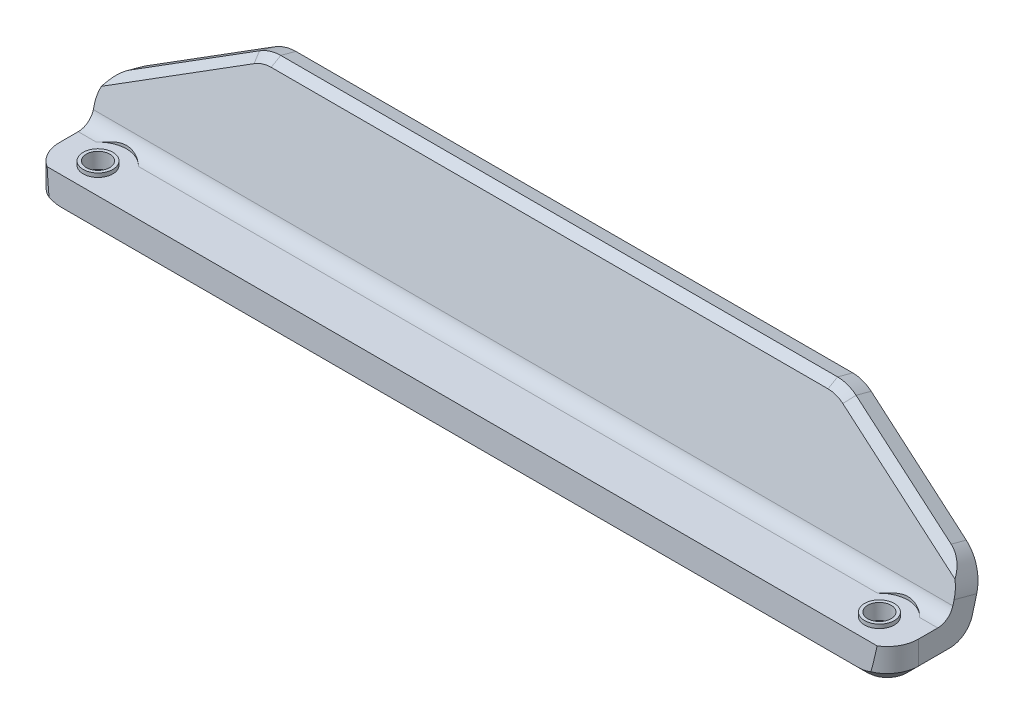
from build123d import *
from build123d.topology import SkipClean

# Parameters (mm, degrees)
SKETCH1_R           = 1.5
BOSS_EXTRUDE1_DEPTH = 4.5
BOSS_EXTRUDE2_DEPTH = 4.5
SKETCH4_W           = 111.548343993
SKETCH4_H           = 26.061405498
CUT_EXTRUDE1_DEPTH  = 60.696351463
FILLET4_R           = 5
FILLET1_R           = 4.5
FILLET2_SIZE        = 1.5
FILLET3_R           = 2
CUT_EXTRUDE2_DEPTH  = 113.379618024
SKETCH6_R           = 3
CUT_EXTRUDE3_DEPTH  = 3
SKETCH7_R           = 3.65
CUT_EXTRUDE4_DEPTH  = 59.224472924
SKETCH8_R           = 1.9
SKETCH8_R_2         = 1.5
BOSS_EXTRUDE3_DEPTH = 0.5
CUT_EXTRUDE5_DEPTH  = 1
CUT_EXTRUDE6_START  = -9.108877
CUT_EXTRUDE6_DEPTH  = 19.773151802
CUT_EXTRUDE7_START  = -32.882028
CUT_EXTRUDE7_DEPTH  = 20.117971694
CUT_EXTRUDE8_DEPTH  = 1
CUT_EXTRUDE9_START  = -28.882028802
CUT_EXTRUDE9_DEPTH  = 19.773151802
CUT_EXTRUDE10_START = -52.999999694
CUT_EXTRUDE10_DEPTH = 20.117971694
CHAMFER2_SIZE       = 1


# Some blends are built 0.0001 mm under size
with BuildPart() as part:
    # Sketch1 → Boss-Extrude1 (new body)
    with BuildSketch(Plane(origin=(0, 0, 0), x_dir=(1, 0, 0), z_dir=(0, 1, 0))):
        with BuildLine():
            Line((51, -4), (-51, -4))
            ThreePointArc((-51, -4), (-53.828427125, -2.828427125), (-55, 0))
            Line((-55, 0), (-55, 4))
            Line((-55, 4), (55, 4))
            Line((55, 4), (55, 0))
            ThreePointArc((55, 0), (53.828427125, -2.828427125), (51, -4))
        make_face()
        with Locations(Location((-50, 0, 0), (0, 0, 270))):
            Circle(SKETCH1_R, mode=Mode.SUBTRACT)
        with Locations(Location((50, 0, 0), (0, 0, 270))):
            Circle(SKETCH1_R, mode=Mode.SUBTRACT)
    extrude(amount=BOSS_EXTRUDE1_DEPTH)

    # Sketch3 → Boss-Extrude2 (add)
    with BuildSketch(Plane(origin=(0, -0.698557159, -2.607050808), x_dir=(0, 0.9659258262890672, -0.25881904510252496), z_dir=(0, -0.25881904510252496, -0.9659258262890672))):
        Polygon((1.03527618, 55), (10.381942399, 55), (21.03527618, 37), (21.03527618, -37), (10.381942399, -55), (1.03527618, -55), align=None)
    extrude(amount=BOSS_EXTRUDE2_DEPTH)

    # Sketch4 → Cut-Extrude1 (cut, through all)
    with BuildSketch(Plane.XZ):
        with Locations((0.774171997, -1.424514274)):
            Rectangle(SKETCH4_W, SKETCH4_H)
    extrude(amount=CUT_EXTRUDE1_DEPTH, mode=Mode.SUBTRACT)

    # Fillet4
    fillet4_edges = [part.edges().sort_by_distance(p)[0] for p in [
        (55, 8.74728628, -7.467428335),
        (-55, 8.74728628, -7.467428335),
        (-37, 19.037616516, -10.224714011),
        (37, 19.037616516, -10.224714011),
    ]]
    fillet(fillet4_edges, radius=FILLET4_R)

    # Fillet1
    fillet1_edges = [part.edges().sort_by_distance(p)[0] for p in [
        (0, 0, -7.452971446),
    ]]
    fillet(fillet1_edges, radius=FILLET1_R)

    # Fillet2
    fillet2_edges = [part.edges().sort_by_distance(p)[0] for p in [
        (55, 0, -2),
        (-45.362278742, 13.674684232, -11.117092043),
        (53.828427125, 0, 2.828427125),
        (0, 18.455273664, -12.39804712),
        (45.362278742, 13.674684232, -11.117092043),
        (55, 4.373280482, -8.624788419),
        (0, 0, 4),
        (54.343573621, 7.80342359, -9.543892495),
        (36.951427354, 18.283885012, -12.352123669),
        (-36.951427354, 18.283885012, -12.352123669),
        (-54.343573621, 7.80342359, -9.543892495),
        (-53.828427125, 0, 2.828427125),
        (-55, 0, -2),
        (55, 0.929909969, -6.739426431),
        (-55, 4.373280482, -8.624788419),
        (-55, 0.929909969, -6.739426431),
    ]]
    chamfer(fillet2_edges, length=FILLET2_SIZE)

    # Fillet3
    fillet3_edges = [part.edges().sort_by_distance(p)[0] for p in [
        (0, 4.5, -4),
    ]]
    fillet(fillet3_edges, radius=FILLET3_R)

    # Sketch5 → Cut-Extrude2 (cut, through all)
    with BuildSketch(Plane(origin=(55, 0, 0), x_dir=(0, 0, -1), z_dir=(1, 0, 0))):
        Polygon((-3.7, 1.2), (-3.4, 4.5), (-4, 4.5), (-4, 1.5), align=None)
    extrude(amount=-CUT_EXTRUDE2_DEPTH, mode=Mode.SUBTRACT)

    # Sketch6 → Cut-Extrude3 (cut)
    with BuildSketch(Plane.XZ):
        with Locations(Location((-50, 0, 0), (0, 0, 270))):
            Circle(SKETCH6_R)
        with Locations(Location((50, 0, 0), (0, 0, 270))):
            Circle(SKETCH6_R)
    extrude(amount=-CUT_EXTRUDE3_DEPTH, mode=Mode.SUBTRACT)

    # Chamfer1
    # the kernel refuses this chamfer: 1 mm, written as the material it takes off along each edge
    with BuildSketch(Plane(origin=(-38.177904762, 18.946568868, -7.870946462), x_dir=(0.5091379751453899, -0.8238169892328391, 0.24920692309041603), z_dir=(-0.8605709712337539, -0.49197552696425445, 0.1318244451459503)), Plane(origin=(57.858130466, 7.695678779, -4.856279548), x_dir=(-0.5091379751453895, -0.8238169892328395, 0.24920692309041592), z_dir=(-0.8605709712337543, 0.491975526964254, -0.13182444514595018))) as chamfer1_piece_1:
        with BuildLine():
            Line((1.028673195, 0), (-0.056547155, -1.027117794))
            Line((-0.056547155, -1.027117794), (-0.076539593, -1.026567876))
            ThreePointArc((-0.076539593, -1.026567876), (-0.034129227, -0.51339783), (-0.019992438, 0.000549918))
            Line((-0.019992438, 0.000549918), (0.000549918, 0.019992438))
            ThreePointArc((0.000549918, 0.019992438), (0.514497665, 0.00585565), (1.029223113, 0.019992438))
            Line((1.029223113, 0.019992438), (1.028673195, 0))
        make_face()
    extrude(amount=22.868800322, mode=Mode.SUBTRACT)
    with BuildSketch(Plane(origin=(35.63125204, 19.619959367, -8.051380902), x_dir=(0, -0.9584441695405964, 0.28528016733316086), z_dir=(-1, 0, 0))) as chamfer1_piece_2:
        with BuildLine():
            Line((1.028673195, 0), (-0.056547155, -1.027117794))
            Line((-0.056547155, -1.027117794), (-0.076539593, -1.026567876))
            ThreePointArc((-0.076539593, -1.026567876), (-0.034129227, -0.51339783), (-0.019992438, 0.000549918))
            Line((-0.019992438, 0.000549918), (0.000549918, 0.019992438))
            ThreePointArc((0.000549918, 0.019992438), (0.514497665, 0.00585565), (1.029223113, 0.019992438))
            Line((1.029223113, 0.019992438), (1.028673195, 0))
        make_face()
    extrude(amount=71.262504079, mode=Mode.SUBTRACT)
    with BuildSketch(Plane(origin=(35.63125204, 14.790330236, -6.757285677), x_dir=(0.5093305444107913, 0.831247726469349, -0.22273215701767274), z_dir=(0.8605709712337541, -0.491975526964254, 0.13182444514595018))) as chamfer1_piece_3:
        with BuildLine():
            Line((3.971715729, 0.028284271), (5.028284271, -1.028284271))
            Line((5.028284271, -1.028284271), (5.048284271, -1.028284271))
            ThreePointArc((5.048284271, -1.028284271), (5.02, -0.514142136), (5.02, 0))
            Line((5.02, 0), (5, 0.02))
            ThreePointArc((5, 0.02), (4.485857864, 0.02), (3.971715729, 0.048284271))
            Line((3.971715729, 0.048284271), (3.971715729, 0.028284271))
        make_face()
    revolve(axis=Axis((35.63125204, 14.790330236, -6.757285677), (0, 0.25881904510252496, 0.9659258262890672)), revolution_arc=30.619247925, mode=Mode.SUBTRACT)
    with BuildSketch(Plane(origin=(-35.63125204, 14.790330236, -6.757285677), x_dir=(0, 0.9659258262890672, -0.2588190451025248), z_dir=(1, 0, 0))) as chamfer1_piece_4:
        with BuildLine():
            Line((3.971715729, 0.028284271), (5.028284271, -1.028284271))
            Line((5.028284271, -1.028284271), (5.048284271, -1.028284271))
            ThreePointArc((5.048284271, -1.028284271), (5.02, -0.514142136), (5.02, 0))
            Line((5.02, 0), (5, 0.02))
            ThreePointArc((5, 0.02), (4.485857864, 0.02), (3.971715729, 0.048284271))
            Line((3.971715729, 0.048284271), (3.971715729, 0.028284271))
        make_face()
    revolve(axis=Axis((-35.63125204, 14.790330236, -6.757285677), (0, 0.25881904510252496, 0.9659258262890672)), revolution_arc=30.619247925, mode=Mode.SUBTRACT)

    # Sketch7 → Cut-Extrude4 (cut, through all)
    with BuildSketch(Plane(origin=(0, 4.5, 0), x_dir=(1, 0, 0), z_dir=(0, 1, 0))):
        with Locations((50, 0)):
            Circle(SKETCH7_R)
        with Locations((-50, 0)):
            Circle(SKETCH7_R)
    extrude(amount=CUT_EXTRUDE4_DEPTH, mode=Mode.SUBTRACT)

    # Sketch8 → Boss-Extrude3 (add)
    # profile 1 of 2: a face of its own
    with BuildSketch(Plane(origin=(0, 4.5, 0), x_dir=(1, 0, 0), z_dir=(0, 1, 0))):
        with Locations(Location((-50, 0, 0), (0, 0, 270))):
            Circle(SKETCH8_R)
        with Locations(Location((-50, 0, 0), (0, 0, 90))):
            Circle(SKETCH8_R_2, mode=Mode.SUBTRACT)
    # profile 2 of 2: a face of its own
    with BuildSketch(Plane(origin=(0, 4.5, 0), x_dir=(1, 0, 0), z_dir=(0, 1, 0))):
        with Locations(Location((50, 0, 0), (0, 0, 270))):
            Circle(SKETCH8_R)
        with Locations(Location((50, 0, 0), (0, 0, 90))):
            Circle(SKETCH8_R_2, mode=Mode.SUBTRACT)
    extrude(amount=BOSS_EXTRUDE3_DEPTH)

    # Sketch9 → Cut-Extrude5 (cut)
    with BuildSketch(Plane(origin=(0, -1.863242861, -6.953717026), x_dir=(-1, 0, 0), z_dir=(0, -0.25881904510252496, -0.9659258262890672))):
        with BuildLine():
            ThreePointArc((-26.117971694, 13.53527618), (-26.703758132, 14.949489743), (-28.117971694, 15.53527618))
            Line((-28.117971694, 15.53527618), (-34.946878059, 15.53527618))
            ThreePointArc((-34.946878059, 15.53527618), (-35.474948185, 15.464302345), (-35.965539148, 15.256418123))
            Line((-35.965539148, 15.256418123), (-44.909784585, 9.962749675))
            ThreePointArc((-44.909784585, 9.962749675), (-45.628552945, 9.232233248), (-45.891123496, 8.241607733))
            Line((-45.891123496, 8.241607733), (-45.891123496, 5.381942399))
            Line((-45.891123496, 5.381942399), (-26.117971694, 5.381942399))
            Line((-26.117971694, 5.381942399), (-26.117971694, 13.53527618))
        make_face()
        with BuildLine():
            Line((-4, 15.53527618), (-20.117971694, 15.53527618))
            ThreePointArc((-20.117971694, 15.53527618), (-21.532185256, 14.949489743), (-22.117971694, 13.53527618))
            Line((-22.117971694, 13.53527618), (-22.117971694, 5.381942399))
            Line((-22.117971694, 5.381942399), (-2, 5.381942399))
            Line((-2, 5.381942399), (-2, 13.53527618))
            ThreePointArc((-2, 13.53527618), (-2.585786438, 14.949489743), (-4, 15.53527618))
        make_face()
    cut_extrude5 = extrude(amount=-CUT_EXTRUDE5_DEPTH, mode=Mode.SUBTRACT)

    # Sketch10 → Cut-Extrude6 (cut)
    with SkipClean():  # the faces are left unmerged after this step: merging them gives an invalid solid
        with BuildSketch(Plane(origin=(55, 0, 0), x_dir=(0, 0, -1), z_dir=(1, 0, 0)).offset(CUT_EXTRUDE6_START)):
            with BuildLine():
                Line((7.380740392, 3.594133342), (8.346666218, 3.335314297))
                ThreePointArc((8.346666218, 3.335314297), (6.739426431, 0.929909969), (4, 0))
                Line((4, 0), (4, 1))
                ThreePointArc((4, 1), (6.130665002, 1.723263309), (7.380740392, 3.594133342))
            make_face()
        extrude(amount=-CUT_EXTRUDE6_DEPTH, mode=Mode.SUBTRACT)

    # Sketch11 → Cut-Extrude7 (cut)
    with SkipClean():  # the faces are left unmerged after this step: merging them gives an invalid solid
        with BuildSketch(Plane(origin=(55, 0, 0), x_dir=(0, 0, -1), z_dir=(1, 0, 0)).offset(CUT_EXTRUDE7_START)):
            with BuildLine():
                Line((7.380740392, 3.594133342), (8.346666218, 3.335314297))
                ThreePointArc((8.346666218, 3.335314297), (6.739426431, 0.929909969), (4, 0))
                Line((4, 0), (4, 1))
                ThreePointArc((4, 1), (6.130665002, 1.723263309), (7.380740392, 3.594133342))
            make_face()
        extrude(amount=-CUT_EXTRUDE7_DEPTH, mode=Mode.SUBTRACT)

    # Sketch12 → Cut-Extrude8 (cut)
    with SkipClean():  # the faces are left unmerged after this step: merging them gives an invalid solid
        with BuildSketch(Plane.XZ):
            with BuildLine():
                Line((2, -4), (22.117971694, -4))
                Line((22.117971694, -4), (22.117971694, -3))
                ThreePointArc((22.117971694, -3), (21.532185256, -1.585786438), (20.117971694, -1))
                Line((20.117971694, -1), (4, -1))
                ThreePointArc((4, -1), (2.585786438, -1.585786438), (2, -3))
                Line((2, -3), (2, -4))
            make_face()
            with BuildLine():
                Line((26.117971694, -4), (45.891123496, -4))
                Line((45.891123496, -4), (45.891123496, -3))
                ThreePointArc((45.891123496, -3), (45.305337058, -1.585786438), (43.891123496, -1))
                Line((43.891123496, -1), (28.117971694, -1))
                ThreePointArc((28.117971694, -1), (26.703758132, -1.585786438), (26.117971694, -3))
                Line((26.117971694, -3), (26.117971694, -4))
            make_face()
        cut_extrude8 = extrude(amount=-CUT_EXTRUDE8_DEPTH, mode=Mode.SUBTRACT)

    # Mirror3: Cut-Extrude5, Cut-Extrude8 across plane
    with SkipClean():  # the faces are left unmerged after this step: merging them gives an invalid solid
        add(cut_extrude5.mirror(Plane(origin=(0, 0, 0), x_dir=(0, 0, 1), z_dir=(1, 0, 0))), mode=Mode.SUBTRACT)
        add(cut_extrude8.mirror(Plane(origin=(0, 0, 0), x_dir=(0, 0, 1), z_dir=(1, 0, 0))), mode=Mode.SUBTRACT)

    # Sketch13 → Cut-Extrude9 (cut)
    with SkipClean():  # the faces are left unmerged after this step: merging them gives an invalid solid
        with BuildSketch(Plane.ZY.offset(55).offset(CUT_EXTRUDE9_START)):
            with BuildLine():
                Line((-4, 1), (-4, 0))
                ThreePointArc((-4, 0), (-6.739426431, 0.929909969), (-8.346666218, 3.335314297))
                Line((-8.346666218, 3.335314297), (-7.380740392, 3.594133342))
                ThreePointArc((-7.380740392, 3.594133342), (-6.130665002, 1.723263309), (-4, 1))
            make_face()
        extrude(amount=CUT_EXTRUDE9_DEPTH, mode=Mode.SUBTRACT)

    # Sketch14 → Cut-Extrude10 (cut)
    with SkipClean():  # the faces are left unmerged after this step: merging them gives an invalid solid
        with BuildSketch(Plane.ZY.offset(55).offset(CUT_EXTRUDE10_START)):
            with BuildLine():
                Line((-4, 1), (-4, 0))
                ThreePointArc((-4, 0), (-6.739426431, 0.929909969), (-8.346666218, 3.335314297))
                Line((-8.346666218, 3.335314297), (-7.380740392, 3.594133342))
                ThreePointArc((-7.380740392, 3.594133342), (-6.130665002, 1.723263309), (-4, 1))
            make_face()
        extrude(amount=CUT_EXTRUDE10_DEPTH, mode=Mode.SUBTRACT)

    # Chamfer2
    chamfer2_edges = [part.edges().sort_by_distance(p)[0] for p in [
        (-45.891123496, 1, -3.5),
        (-45.305337058, 1, -1.585786438),
        (-45.891123, 1.723263309, -6.130665002),
        (-36.004547595, 1, -1),
        (-45.891123496, 4.975245642, -7.750808318),
        (-26.703758132, 1, -1.585786438),
        (-45.628552945, 7.313228712, -8.377268993),
        (-26.117971694, 1, -3.5),
        (-40.437661867, 10.57549893, -9.251391663),
        (-26.117971198, 1.723263309, -6.130665002),
        (-35.474948185, 13.332945204, -9.990247166),
        (-26.117971694, 7.531891177, -8.435859424),
        (-31.532424877, 13.401500665, -10.008616546),
        (-26.703758132, 12.835674416, -9.85700386),
        (-21.532185256, 1, -1.585786438),
        (-22.117971694, 1, -3.5),
        (-12.058985847, 1, -1),
        (-22.117972, 1.723263309, -6.130665002),
        (-2.585786438, 1, -1.585786438),
        (-22.117971694, 7.531891177, -8.435859424),
        (-2, 1, -3.5),
        (-21.532185256, 12.835674416, -9.85700386),
        (-2.000000306, 1.723263309, -6.130665002),
        (-12.058985847, 13.401500665, -10.008616546),
        (-2, 7.531891177, -8.435859424),
        (-2.585786438, 12.835674416, -9.85700386),
        (2.585786438, 1, -1.585786438),
        (2, 1, -3.5),
        (12.058985847, 1, -1),
        (22.117972, 1.723263309, -6.130665002),
        (2.000000306, 1.723263309, -6.130665002),
        (21.532185256, 1, -1.585786438),
        (2, 7.531891177, -8.435859424),
        (22.117971694, 1, -3.5),
        (2.585786438, 12.835674416, -9.85700386),
        (12.058985847, 13.401500665, -10.008616546),
        (22.117971694, 7.531891177, -8.435859424),
        (21.532185256, 12.835674416, -9.85700386),
        (26.117971694, 1, -3.5),
        (26.703758132, 1, -1.585786438),
        (45.891123, 1.723263309, -6.130665002),
        (26.117971198, 1.723263309, -6.130665002),
        (36.004547595, 1, -1),
        (26.117971694, 7.531891177, -8.435859424),
        (45.305337058, 1, -1.585786438),
        (26.703758132, 12.835674416, -9.85700386),
        (45.891123496, 1, -3.5),
        (31.532424877, 13.401500665, -10.008616546),
        (35.474948185, 13.332945204, -9.990247166),
        (45.891123496, 4.975245642, -7.750808318),
        (40.437661867, 10.57549893, -9.251391663),
        (45.628552945, 7.313228712, -8.377268993),
    ]]
    chamfer(chamfer2_edges, length=CHAMFER2_SIZE - 0.0001)  # a hair under: the kernel refuses the full size


solid = part.part
